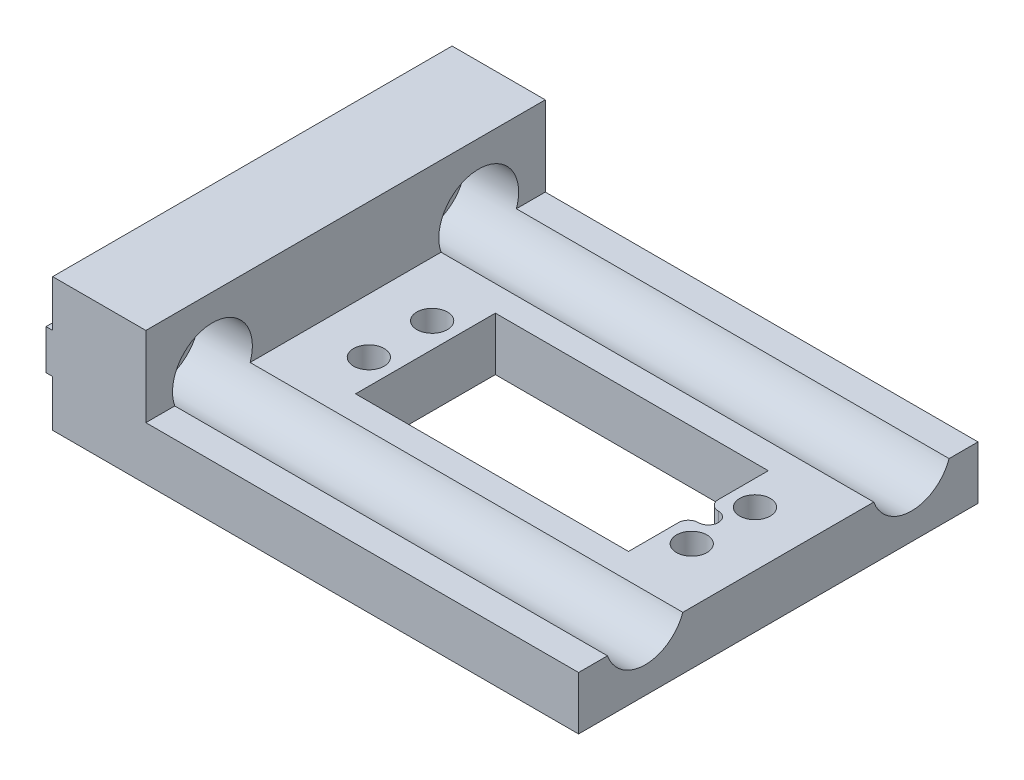
from build123d import *

# Parameters (mm, degrees)
SALIENTE_EXTRUIR1_DEPTH = 60
CROQUIS2_R              = 2.75
CORTAR_EXTRUIR1_DEPTH   = 91.691785736
CROQUIS4_R              = 6
CORTAR_EXTRUIR2_DEPTH   = 73
CROQUIS5_W              = 41
CROQUIS5_H              = 21
CORTAR_EXTRUIR3_DEPTH   = 100.924971854
CROQUIS6_R              = 2.3
CORTAR_EXTRUIR4_DEPTH   = 100.924971854
CROQUIS7_W              = 3
CROQUIS7_H              = 3
CORTAR_EXTRUIR5_DEPTH   = 90.269255626
REDONDEO3_R             = 1.5


with BuildPart() as part:
    # Croquis1 → Saliente-Extruir1 (new body)
    with BuildSketch(Plane.XY):
        Polygon((0, 0), (0, -7), (-1, -7), (-1, -13), (0, -13), (0, -20), (79, -20), (79, -12), (14, -12), (14, 0), align=None)
    extrude(amount=SALIENTE_EXTRUIR1_DEPTH)

    # Croquis2 → Cortar-Extruir1 (cut, through all)
    with BuildSketch(Plane(origin=(14, 0, 0), x_dir=(0, 0, -1), z_dir=(1, 0, 0))):
        with Locations((-50, -10)):
            Circle(CROQUIS2_R)
        with Locations((-10, -10)):
            Circle(CROQUIS2_R)
    extrude(amount=-CORTAR_EXTRUIR1_DEPTH, mode=Mode.SUBTRACT)

    # Croquis4 → Cortar-Extruir2 (cut)
    with BuildSketch(Plane(origin=(79, 0, 0), x_dir=(0, 0, -1), z_dir=(1, 0, 0))):
        with Locations((-50, -10)):
            Circle(CROQUIS4_R)
        with Locations((-10, -10)):
            Circle(CROQUIS4_R)
    extrude(amount=-CORTAR_EXTRUIR2_DEPTH, mode=Mode.SUBTRACT)

    # Croquis5 → Cortar-Extruir3 (cut, through all)
    with BuildSketch(Plane(origin=(0, -12, 0), x_dir=(1, 0, 0), z_dir=(0, 1, 0))):
        with Locations((46.5, -30)):
            Rectangle(CROQUIS5_W, CROQUIS5_H)
    extrude(amount=-CORTAR_EXTRUIR3_DEPTH, mode=Mode.SUBTRACT)

    # Croquis6 → Cortar-Extruir4 (cut, through all)
    with BuildSketch(Plane(origin=(0, -12, 0), x_dir=(1, 0, 0), z_dir=(0, 1, 0))):
        with Locations(Location((22.25, -25.25, 0), (0, 0, 180))):
            Circle(CROQUIS6_R)
        with Locations(Location((22.25, -34.75, 0), (0, 0, 180))):
            Circle(CROQUIS6_R)
        with Locations(Location((70.75, -25.25, 0), (0, 0, 180))):
            Circle(CROQUIS6_R)
        with Locations(Location((70.75, -34.75, 0), (0, 0, 180))):
            Circle(CROQUIS6_R)
    extrude(amount=-CORTAR_EXTRUIR4_DEPTH, mode=Mode.SUBTRACT)

    # Croquis7 → Cortar-Extruir5 (cut, through all)
    with BuildSketch(Plane(origin=(14, -12, 60), x_dir=(1, 0, 0), z_dir=(0, 1, 0))):
        with Locations((54.5, 30)):
            Rectangle(CROQUIS7_W, CROQUIS7_H)
    extrude(amount=-CORTAR_EXTRUIR5_DEPTH, mode=Mode.SUBTRACT)

    # Redondeo3
    redondeo3_edges = [part.edges().sort_by_distance(p)[0] for p in [
        (70, -16, 31.5),
        (70, -16, 28.5),
    ]]
    fillet(redondeo3_edges, radius=REDONDEO3_R - 0.0001)  # a hair under: the kernel refuses the full size
    redondeo3_2_edges = [part.edges().sort_by_distance(p)[0] for p in [
        (67, -16, 28.5),
        (67, -16, 31.5),
    ]]
    fillet(redondeo3_2_edges, radius=REDONDEO3_R)


solid = part.part
